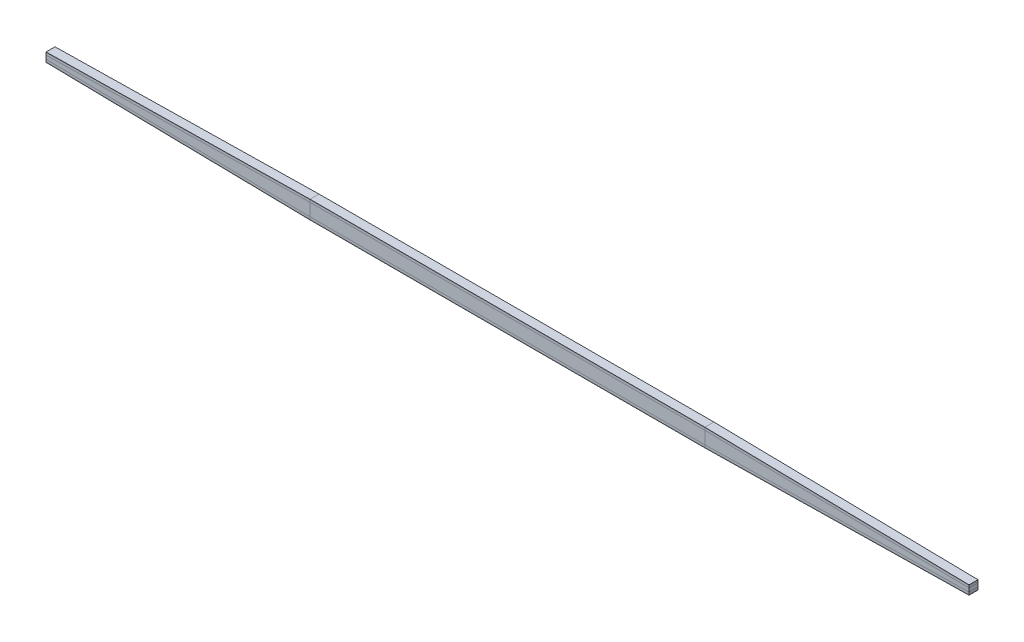
from build123d import *

# Parameters (mm, degrees)
BOSS_EXTRUDE1_DEPTH      = 6.35
SPLIT1_SURFACE_1_1_BACK  = 1307.646
SPLIT1_SURFACE_1_1_DEPTH = 2615.292
SPLIT1_SURFACE_1_2_BACK  = 1307.646
SPLIT1_SURFACE_1_2_DEPTH = 2615.292
SPLIT1_SURFACE_2_3_BACK  = 1307.646
SPLIT1_SURFACE_2_3_DEPTH = 2615.292
SPLIT1_SURFACE_2_4_BACK  = 1307.646
SPLIT1_SURFACE_2_4_DEPTH = 2615.292
SPLIT1_SURFACE_4_5_BACK  = 1307.646
SPLIT1_SURFACE_4_5_DEPTH = 2615.292
SPLIT1_SURFACE_4_6_BACK  = 1307.646
SPLIT1_SURFACE_4_6_DEPTH = 2615.292
SPLIT1_SURFACE_5_7_BACK  = 1307.646
SPLIT1_SURFACE_5_7_DEPTH = 2615.292
SPLIT1_SURFACE_5_8_BACK  = 1307.646
SPLIT1_SURFACE_5_8_DEPTH = 2615.292
SPLIT2_START             = -653.16862
SPLIT2_OUTLINE_W         = 8.7
SPLIT2_OUTLINE_H         = 12.7
SPLIT2_DEPTH             = 932.56862
SPLIT2_START_2           = -6.35
SPLIT2_2_DEPTH           = 12.7
SPLIT2_START_3           = 12.039904759
SPLIT2_3_OUTLINE_W       = 558.8
SPLIT2_3_OUTLINE_H       = 12.7
SPLIT2_3_DEPTH           = 0.660095241
SPLIT2_4_OUTLINE_W       = 11.039904759
SPLIT2_4_OUTLINE_H       = 12.7
SPLIT2_4_DEPTH           = 932.56862
SPLIT2_5_DEPTH           = 12.7
SPLIT2_START_4           = 8.85944587
SPLIT2_6_OUTLINE_W       = 558.8
SPLIT2_6_OUTLINE_H       = 12.7
SPLIT2_6_DEPTH           = 3.180458889
SPLIT2_7_DEPTH           = 12.7
SPLIT2_8_DEPTH           = 12.7
SPLIT2_9_OUTLINE_W       = 20
SPLIT2_9_OUTLINE_H       = 12.7
SPLIT2_9_DEPTH           = 373.76862
SPLIT2_START_5           = 279.4
SPLIT2_10_OUTLINE_W      = 20
SPLIT2_10_OUTLINE_H      = 12.7
SPLIT2_10_DEPTH          = 373.76862
SPLIT2_11_OUTLINE_W      = 11.039904759
SPLIT2_11_OUTLINE_H      = 12.7
SPLIT2_11_DEPTH          = 932.56862
SPLIT2_12_DEPTH          = 12.7
SPLIT2_START_6           = -12.039904759
SPLIT2_13_OUTLINE_W      = 558.8
SPLIT2_13_OUTLINE_H      = 12.7
SPLIT2_13_DEPTH          = 3.180458889
SPLIT2_14_OUTLINE_W      = 8.7
SPLIT2_14_OUTLINE_H      = 12.7
SPLIT2_14_DEPTH          = 932.56862
SPLIT2_15_DEPTH          = 12.7
SPLIT2_16_OUTLINE_W      = 558.8
SPLIT2_16_OUTLINE_H      = 0.660095241
SPLIT2_16_DEPTH          = 12.7


# Read off the part's stored shape, not the designer's step: Split2
with BuildPart() as part:
    # Sketch1 → Boss-Extrude1 (new, symmetric)
    with BuildSketch(Plane.XY):
        Polygon((-653.16862, 6.35), (-653.16862, -6.35), (-279.4, -12.7), (0, -12.7), (0, 12.7), (-279.4, 12.7), align=None)
    boss_extrude1 = extrude(amount=BOSS_EXTRUDE1_DEPTH, both=True)

    # Mirror1: Boss-Extrude1 across Right Plane
    add(boss_extrude1.mirror(Plane(origin=(0, 0, 0), x_dir=(0, 0, -1), z_dir=(1, 0, 0))))


with BuildPart() as body_2:
    # Split1: the piece behind the surface
    add(part.part)
    # Split1 surface 1: a surface, the sketch's curves swept straight by 2615.292 mm
    with BuildLine(Plane.XY.offset(6.35).offset(-SPLIT1_SURFACE_1_1_BACK), mode=Mode.PRIVATE) as split1_surface_1_1_path:
        Line((653.16862, 5.689904759), (279.4, 12.039904759))
        Line((279.4, 12.039904759), (-279.4, 12.039904759))
        Line((-279.4, 12.039904759), (-653.16862, 5.689904759))
    split1_surface_1_1 = Shell.extrude(split1_surface_1_1_path.wire(), (0 * SPLIT1_SURFACE_1_1_DEPTH, 0 * SPLIT1_SURFACE_1_1_DEPTH, 1 * SPLIT1_SURFACE_1_1_DEPTH))
    split(bisect_by=split1_surface_1_1, keep=Keep.BOTTOM)

    # Split2 outline → Split2 (cut)
    with BuildSketch(Plane.YZ.offset(SPLIT2_START)):
        with Locations((8.35, 0)):
            Rectangle(SPLIT2_OUTLINE_W, SPLIT2_OUTLINE_H)
    extrude(amount=SPLIT2_DEPTH, mode=Mode.SUBTRACT)


with BuildPart() as part_1:
    add(part.part)

    # Split1: split by a surface, the side it looks to stays
    # Split1 surface 1: a surface, the sketch's curves swept straight by 2615.292 mm
    with BuildLine(Plane.XY.offset(6.35).offset(-SPLIT1_SURFACE_1_2_BACK), mode=Mode.PRIVATE) as split1_surface_1_2_path:
        Line((653.16862, 5.689904759), (279.4, 12.039904759))
        Line((279.4, 12.039904759), (-279.4, 12.039904759))
        Line((-279.4, 12.039904759), (-653.16862, 5.689904759))
    split1_surface_1_2 = Shell.extrude(split1_surface_1_2_path.wire(), (0 * SPLIT1_SURFACE_1_2_DEPTH, 0 * SPLIT1_SURFACE_1_2_DEPTH, 1 * SPLIT1_SURFACE_1_2_DEPTH))
    split(bisect_by=split1_surface_1_2, keep=Keep.TOP)


with BuildPart() as body_3:
    # Split1 2: the piece behind the surface
    add(part_1.part)
    # Split1 surface 2: a surface, the sketch's curves swept straight by 2615.292 mm
    with BuildLine(Plane.XY.offset(6.35).offset(-SPLIT1_SURFACE_2_3_BACK), mode=Mode.PRIVATE) as split1_surface_2_3_path:
        Line((653.16862, 2.50944587), (279.4, 8.85944587))
        Line((279.4, 8.85944587), (-279.4, 8.85944587))
        Line((-279.4, 8.85944587), (-653.16862, 2.50944587))
    split1_surface_2_3 = Shell.extrude(split1_surface_2_3_path.wire(), (0 * SPLIT1_SURFACE_2_3_DEPTH, 0 * SPLIT1_SURFACE_2_3_DEPTH, 1 * SPLIT1_SURFACE_2_3_DEPTH))
    split(bisect_by=split1_surface_2_3, keep=Keep.BOTTOM)

    # Split2 4 outline → Split2 4 (cut)
    with BuildSketch(Plane.YZ.offset(SPLIT2_START)):
        with Locations((6.51995238, 0)):
            Rectangle(SPLIT2_4_OUTLINE_W, SPLIT2_4_OUTLINE_H)
    extrude(amount=SPLIT2_4_DEPTH, mode=Mode.SUBTRACT)


with BuildPart() as part_2:
    add(part_1.part)

    # Split1 2: split by a surface, the side it looks to stays
    # Split1 surface 2: a surface, the sketch's curves swept straight by 2615.292 mm
    with BuildLine(Plane.XY.offset(6.35).offset(-SPLIT1_SURFACE_2_4_BACK), mode=Mode.PRIVATE) as split1_surface_2_4_path:
        Line((653.16862, 2.50944587), (279.4, 8.85944587))
        Line((279.4, 8.85944587), (-279.4, 8.85944587))
        Line((-279.4, 8.85944587), (-653.16862, 2.50944587))
    split1_surface_2_4 = Shell.extrude(split1_surface_2_4_path.wire(), (0 * SPLIT1_SURFACE_2_4_DEPTH, 0 * SPLIT1_SURFACE_2_4_DEPTH, 1 * SPLIT1_SURFACE_2_4_DEPTH))
    split(bisect_by=split1_surface_2_4, keep=Keep.TOP)


with BuildPart() as body_4_3:
    # Split1 4: the piece behind the surface
    add(part_2.part)
    # Split1 surface 4: a surface, the sketch's curves swept straight by 2615.292 mm
    with BuildLine(Plane.XY.offset(6.35).offset(-SPLIT1_SURFACE_4_5_BACK), mode=Mode.PRIVATE) as split1_surface_4_5_path:
        Line((-653.16862, -2.50944587), (-279.4, -8.85944587))
        Line((-279.4, -8.85944587), (279.4, -8.85944587))
        Line((279.4, -8.85944587), (653.16862, -2.50944587))
    split1_surface_4_5 = Shell.extrude(split1_surface_4_5_path.wire(), (0 * SPLIT1_SURFACE_4_5_DEPTH, 0 * SPLIT1_SURFACE_4_5_DEPTH, 1 * SPLIT1_SURFACE_4_5_DEPTH))
    split(bisect_by=split1_surface_4_5, keep=Keep.BOTTOM)


with BuildPart() as part_3:
    add(part_2.part)

    # Split1 4: split by a surface, the side it looks to stays
    # Split1 surface 4: a surface, the sketch's curves swept straight by 2615.292 mm
    with BuildLine(Plane.XY.offset(6.35).offset(-SPLIT1_SURFACE_4_6_BACK), mode=Mode.PRIVATE) as split1_surface_4_6_path:
        Line((-653.16862, -2.50944587), (-279.4, -8.85944587))
        Line((-279.4, -8.85944587), (279.4, -8.85944587))
        Line((279.4, -8.85944587), (653.16862, -2.50944587))
    split1_surface_4_6 = Shell.extrude(split1_surface_4_6_path.wire(), (0 * SPLIT1_SURFACE_4_6_DEPTH, 0 * SPLIT1_SURFACE_4_6_DEPTH, 1 * SPLIT1_SURFACE_4_6_DEPTH))
    split(bisect_by=split1_surface_4_6, keep=Keep.TOP)

    # Split2 9 outline → Split2 9 (cut)
    with BuildSketch(Plane.YZ.offset(SPLIT2_START)):
        Rectangle(SPLIT2_9_OUTLINE_W, SPLIT2_9_OUTLINE_H)
    extrude(amount=SPLIT2_9_DEPTH, mode=Mode.SUBTRACT)

    # Split2 10 outline → Split2 10 (cut)
    with BuildSketch(Plane.YZ.offset(SPLIT2_START_5)):
        Rectangle(SPLIT2_10_OUTLINE_W, SPLIT2_10_OUTLINE_H)
    extrude(amount=SPLIT2_10_DEPTH, mode=Mode.SUBTRACT)


with BuildPart() as body_5_2:
    # Split1 5 body 4 3: the piece behind the surface
    add(body_4_3.part)
    # Split1 surface 5: a surface, the sketch's curves swept straight by 2615.292 mm
    with BuildLine(Plane.XY.offset(6.35).offset(-SPLIT1_SURFACE_5_7_BACK), mode=Mode.PRIVATE) as split1_surface_5_7_path:
        Line((-653.16862, -5.689904759), (-279.4, -12.039904759))
        Line((-279.4, -12.039904759), (279.4, -12.039904759))
        Line((279.4, -12.039904759), (653.16862, -5.689904759))
    split1_surface_5_7 = Shell.extrude(split1_surface_5_7_path.wire(), (0 * SPLIT1_SURFACE_5_7_DEPTH, 0 * SPLIT1_SURFACE_5_7_DEPTH, 1 * SPLIT1_SURFACE_5_7_DEPTH))
    split(bisect_by=split1_surface_5_7, keep=Keep.BOTTOM)

    # Split2 14 outline → Split2 14 (cut)
    with BuildSketch(Plane.YZ.offset(SPLIT2_START)):
        with Locations((-8.35, 0)):
            Rectangle(SPLIT2_14_OUTLINE_W, SPLIT2_14_OUTLINE_H)
    extrude(amount=SPLIT2_14_DEPTH, mode=Mode.SUBTRACT)


with BuildPart() as body_4_3_1:
    add(body_4_3.part)

    # Split1 5 body 4 3: split by a surface, the side it looks to stays
    # Split1 surface 5: a surface, the sketch's curves swept straight by 2615.292 mm
    with BuildLine(Plane.XY.offset(6.35).offset(-SPLIT1_SURFACE_5_8_BACK), mode=Mode.PRIVATE) as split1_surface_5_8_path:
        Line((-653.16862, -5.689904759), (-279.4, -12.039904759))
        Line((-279.4, -12.039904759), (279.4, -12.039904759))
        Line((279.4, -12.039904759), (653.16862, -5.689904759))
    split1_surface_5_8 = Shell.extrude(split1_surface_5_8_path.wire(), (0 * SPLIT1_SURFACE_5_8_DEPTH, 0 * SPLIT1_SURFACE_5_8_DEPTH, 1 * SPLIT1_SURFACE_5_8_DEPTH))
    split(bisect_by=split1_surface_5_8, keep=Keep.TOP)

    # Split2 11 outline → Split2 11 (cut)
    with BuildSketch(Plane.YZ.offset(SPLIT2_START)):
        with Locations((-6.51995238, 0)):
            Rectangle(SPLIT2_11_OUTLINE_W, SPLIT2_11_OUTLINE_H)
    extrude(amount=SPLIT2_11_DEPTH, mode=Mode.SUBTRACT)


with BuildPart() as body_6_2:
    # Split2 2 outline → Split2 2 (new body)
    with BuildSketch(Plane.XY.offset(SPLIT2_START_2)):
        Polygon((-279.4, 12.039904759), (-279.4, 12.7), (-653.16862, 6.35), (-653.16862, 5.689904759), align=None)
    extrude(amount=SPLIT2_2_DEPTH)


with BuildPart() as body_7:
    # Split2 3 outline → Split2 3 (new body)
    with BuildSketch(Plane(origin=(0, 0, 0), x_dir=(1, 0, 0), z_dir=(0, 1, 0)).offset(SPLIT2_START_3)):
        Rectangle(SPLIT2_3_OUTLINE_W, SPLIT2_3_OUTLINE_H)
    extrude(amount=SPLIT2_3_DEPTH)


with BuildPart() as body_8:
    # Split2 5 outline → Split2 5 (new body)
    with BuildSketch(Plane.XY.offset(SPLIT2_START_2)):
        Polygon((-279.4, 8.85944587), (-279.4, 12.039904759), (-653.16862, 5.689904759), (-653.16862, 2.50944587), align=None)
    extrude(amount=SPLIT2_5_DEPTH)


with BuildPart() as body_9:
    # Split2 6 outline → Split2 6 (new body)
    with BuildSketch(Plane(origin=(0, 0, 0), x_dir=(1, 0, 0), z_dir=(0, 1, 0)).offset(SPLIT2_START_4)):
        Rectangle(SPLIT2_6_OUTLINE_W, SPLIT2_6_OUTLINE_H)
    extrude(amount=SPLIT2_6_DEPTH)


with BuildPart() as body_10:
    # Split2 7 outline → Split2 7 (new body)
    with BuildSketch(Plane.XY.offset(SPLIT2_START_2)):
        Polygon((653.16862, 2.50944587), (279.4, 8.85944587), (279.4, -8.85944587), (653.16862, -2.50944587), align=None)
    extrude(amount=SPLIT2_7_DEPTH)


with BuildPart() as body_11:
    # Split2 8 outline → Split2 8 (new body)
    with BuildSketch(Plane.XY.offset(SPLIT2_START_2)):
        Polygon((-279.4, -8.85944587), (-279.4, 8.85944587), (-653.16862, 2.50944587), (-653.16862, -2.50944587), align=None)
    extrude(amount=SPLIT2_8_DEPTH)


with BuildPart() as body_12:
    # Split2 12 outline → Split2 12 (new body)
    with BuildSketch(Plane.XY.offset(SPLIT2_START_2)):
        Polygon((-279.4, -12.039904759), (-279.4, -8.85944587), (-653.16862, -2.50944587), (-653.16862, -5.689904759), align=None)
    extrude(amount=SPLIT2_12_DEPTH)


with BuildPart() as body_13:
    # Split2 13 outline → Split2 13 (new body)
    with BuildSketch(Plane(origin=(0, 0, 0), x_dir=(1, 0, 0), z_dir=(0, 1, 0)).offset(SPLIT2_START_6)):
        Rectangle(SPLIT2_13_OUTLINE_W, SPLIT2_13_OUTLINE_H)
    extrude(amount=SPLIT2_13_DEPTH)


with BuildPart() as body_14:
    # Split2 15 outline → Split2 15 (new body)
    with BuildSketch(Plane.XY.offset(SPLIT2_START_2)):
        Polygon((-279.4, -12.7), (-279.4, -12.039904759), (-653.16862, -5.689904759), (-653.16862, -6.35), align=None)
    extrude(amount=SPLIT2_15_DEPTH)


with BuildPart() as body_15:
    # Split2 16 outline → Split2 16 (new body)
    with BuildSketch(Plane.XY.offset(SPLIT2_START_2)):
        with Locations((0, -12.36995238)):
            Rectangle(SPLIT2_16_OUTLINE_W, SPLIT2_16_OUTLINE_H)
    extrude(amount=SPLIT2_16_DEPTH)


solid = Compound([body_2.part, body_3.part, part_3.part, body_5_2.part, body_4_3_1.part, body_6_2.part, body_7.part, body_8.part, body_9.part, body_10.part, body_11.part, body_12.part, body_13.part, body_14.part, body_15.part])
